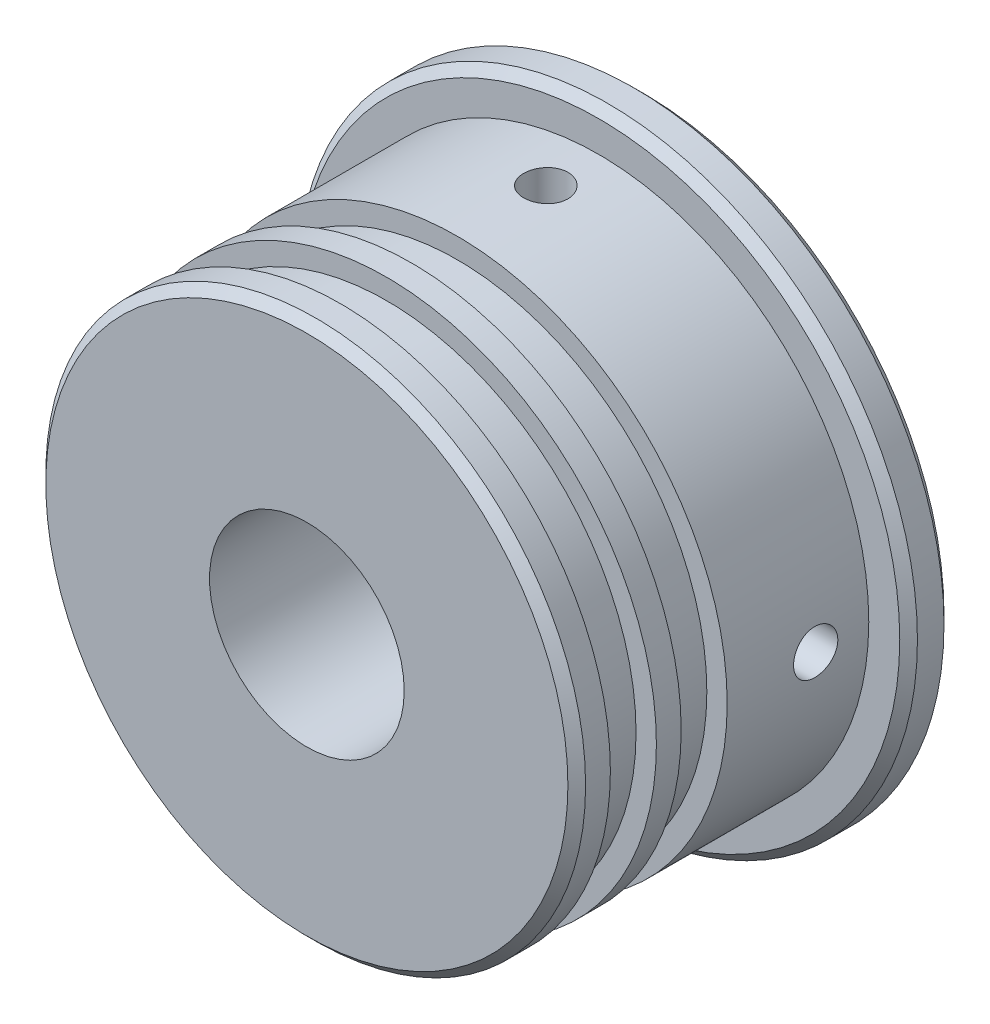
from build123d import *

# Parameters (mm, degrees)
SKETCH_1_R               = 17.5
SKETCH_1_R_2             = 5.5
EXTRUDE_1_DEPTH          = 2.5
EXTRUDE_START            = 16.5
SKETCH_1_3_R             = 15.25
SKETCH_1_3_R_2           = 5.5
EXTRUDE_2_DEPTH          = 16.5
CUT_EXTRUDE_START        = 10.6
SKETCH_1_4_R             = 15.25
SKETCH_1_4_R_2           = 14.1
CUT_EXTRUDE_1_DEPTH      = 2.6
CUT_EXTRUDE_START_2      = 14.6
SKETCH_1_5_R             = 15.25
SKETCH_1_5_R_2           = 14.1
CUT_EXTRUDE_2_DEPTH      = 2.6
CHAMFER_1_SIZE           = 0.5
SKETCH_2_R               = 6
CUT_EXTRUDE_3_DEPTH      = 2.5
CUT_EXTRUDE_START_3      = 10
SKETCH_3_R               = 1.25
CUT_EXTRUDE_4_DEPTH      = 10
PATTERN_CIRCULAR_1_COUNT = 4


with BuildPart() as part:
    # Эскиз1 → Бобышка-Вытянуть1 (new body)
    with BuildSketch(Plane.XY):
        Circle(SKETCH_1_R)
        Circle(SKETCH_1_R_2, mode=Mode.SUBTRACT)
    extrude(amount=-EXTRUDE_1_DEPTH)

    # Эскиз1<3> → Бобышка-Вытянуть2 (add)
    with BuildSketch(Plane.XY.offset(EXTRUDE_START)):
        Circle(SKETCH_1_3_R)
        Circle(SKETCH_1_3_R_2, mode=Mode.SUBTRACT)
    extrude(amount=-EXTRUDE_2_DEPTH)

    # Эскиз1<4> → Вырез-Вытянуть1 (cut)
    with BuildSketch(Plane.XY.offset(CUT_EXTRUDE_START)):
        Circle(SKETCH_1_4_R)
        Circle(SKETCH_1_4_R_2, mode=Mode.SUBTRACT)
    extrude(amount=-CUT_EXTRUDE_1_DEPTH, mode=Mode.SUBTRACT)

    # Эскиз1<5> → Вырез-Вытянуть2 (cut)
    with BuildSketch(Plane.XY.offset(CUT_EXTRUDE_START_2)):
        Circle(SKETCH_1_5_R)
        Circle(SKETCH_1_5_R_2, mode=Mode.SUBTRACT)
    extrude(amount=-CUT_EXTRUDE_2_DEPTH, mode=Mode.SUBTRACT)

    # Фаска1
    chamfer_1_edges = [part.edges().sort_by_distance(p)[0] for p in [
        (-15.25, 0, 16.5),
        (-17.5, 0, 0),
        (-17.5, 0, -2.5),
    ]]
    chamfer(chamfer_1_edges, length=CHAMFER_1_SIZE)

    # Эскиз2 → Вырез-Вытянуть3 (cut)
    with BuildSketch(Plane(origin=(0, 0, -2.5), x_dir=(-1, 0, 0), z_dir=(0, 0, -1))):
        Circle(SKETCH_2_R)
    extrude(amount=-CUT_EXTRUDE_3_DEPTH, mode=Mode.SUBTRACT)

    # Эскиз3 → Вырез-Вытянуть4 (cut)
    with BuildSketch(Plane(origin=(0, 0, 0), x_dir=(1, 0, 0), z_dir=(0, 1, 0)).offset(CUT_EXTRUDE_START_3)):
        with Locations((0, -3)):
            Circle(SKETCH_3_R)
    cut_extrude_4 = extrude(amount=CUT_EXTRUDE_4_DEPTH, mode=Mode.SUBTRACT)

    # Круговой массив1: Вырез-Вытянуть4 ×4 about axis
    pattern_circular_1_axis = Axis((0, 0, 0), (0, 0, -1))
    for i in range(1, PATTERN_CIRCULAR_1_COUNT):
        add(cut_extrude_4.rotate(pattern_circular_1_axis, i * 360 / PATTERN_CIRCULAR_1_COUNT), mode=Mode.SUBTRACT)


solid = part.part
